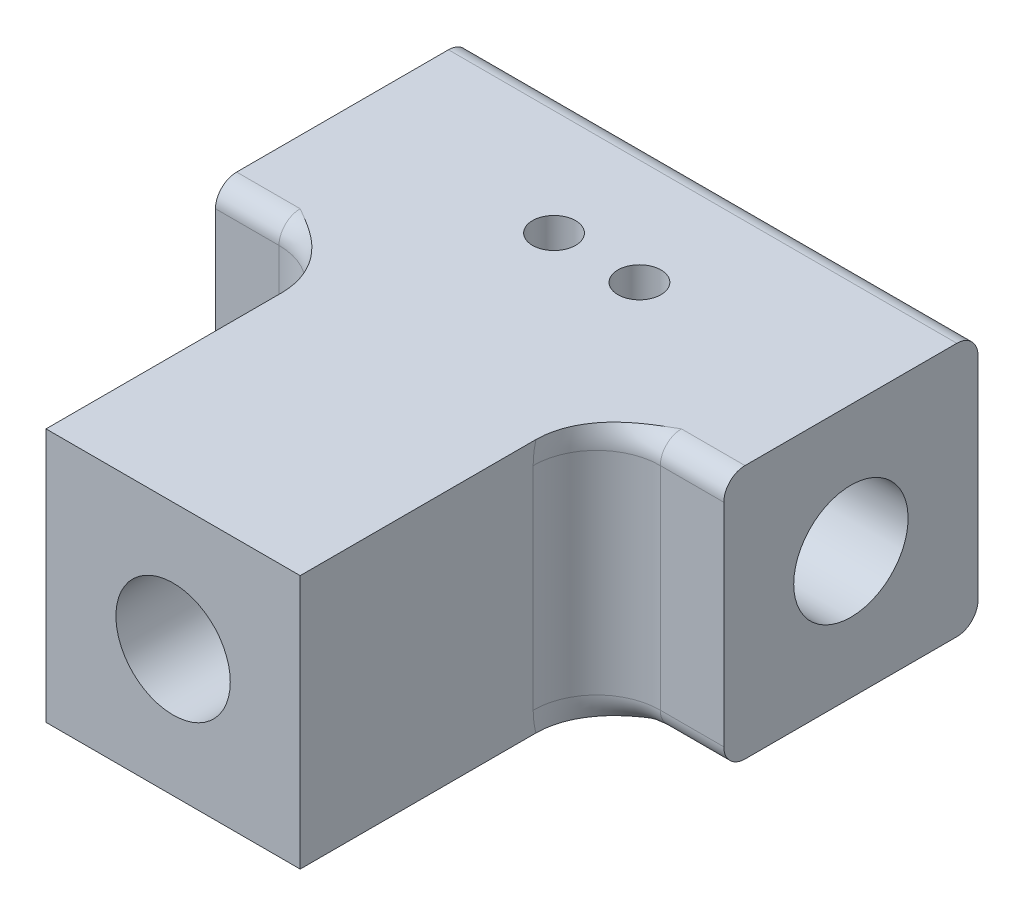
from build123d import *

# Parameters (mm, degrees)
SKETCH1_W                  = 12
SKETCH1_H                  = 6
BOSS_EXTRUDE1_DEPTH        = 6
F_60_0_04_DIAMETER_HOLE1_D = 1.016
SKETCH15_W                 = 6
SKETCH15_H                 = 6
BOSS_EXTRUDE2_DEPTH        = 7
FILLET4_R                  = 0.5
FILLET3_R                  = 1.5
SKETCH19_R                 = 1.35
CUT_EXTRUDE1_DEPTH         = 5.5
SKETCH16_R                 = 1.35
CUT_EXTRUDE2_DEPTH         = 5


with BuildPart() as part:
    # Sketch1 → Boss-Extrude1 (new body)
    with BuildSketch(Plane(origin=(0, 0, 0), x_dir=(1, 0, 0), z_dir=(0, 1, 0))):
        Rectangle(SKETCH1_W, SKETCH1_H)
    extrude(amount=BOSS_EXTRUDE1_DEPTH)

    # #60 (0.04) Diameter Hole1 (through all)
    with Locations(Plane(origin=(0, 6, 0), x_dir=(1, 0, 0), z_dir=(0, 1, 0))):
        with Locations((1.008, 0), (-1.008, 0)):
            Hole(F_60_0_04_DIAMETER_HOLE1_D / 2)

    # Sketch15 → Boss-Extrude2 (add)
    with BuildSketch(Plane.XY.offset(3)):
        with Locations((0, 3)):
            Rectangle(SKETCH15_W, SKETCH15_H)
    extrude(amount=BOSS_EXTRUDE2_DEPTH)

    # Fillet4
    fillet4_edges = [part.edges().sort_by_distance(p)[0] for p in [
        (4.5, 6, 3),
        (4.5, 0, 3),
        (-4.5, 0, 3),
        (0, 0, -3),
        (0, 6, -3),
        (-4.5, 6, 3),
    ]]
    fillet(fillet4_edges, radius=FILLET4_R)

    # Fillet3
    fillet3_edges = [part.edges().sort_by_distance(p)[0] for p in [
        (-3, 3, 3),
        (-3, 0.146446609, 2.853553391),
        (-3, 5.853553391, 2.853553391),
    ]]
    fillet(fillet3_edges, radius=FILLET3_R)
    fillet3_2_edges = [part.edges().sort_by_distance(p)[0] for p in [
        (3, 5.853553391, 2.853553391),
        (3, 3, 3),
        (3, 0.146446609, 2.853553391),
    ]]
    fillet(fillet3_2_edges, radius=FILLET3_R)

    # Sketch19 → Cut-Extrude1 (cut)
    with BuildSketch(Plane.ZY.offset(6)):
        with Locations((0, 3)):
            Circle(SKETCH19_R)
    cut_extrude1 = extrude(amount=-CUT_EXTRUDE1_DEPTH, mode=Mode.SUBTRACT)

    # Sketch16 → Cut-Extrude2 (cut)
    with BuildSketch(Plane.XY.offset(10)):
        with Locations((0, 3)):
            Circle(SKETCH16_R)
    extrude(amount=-CUT_EXTRUDE2_DEPTH, mode=Mode.SUBTRACT)

    # Mirror2: Cut-Extrude1 across plane
    add(cut_extrude1.mirror(Plane(origin=(0, 0, 0), x_dir=(0, 0, 1), z_dir=(1, 0, 0))), mode=Mode.SUBTRACT)


solid = part.part
